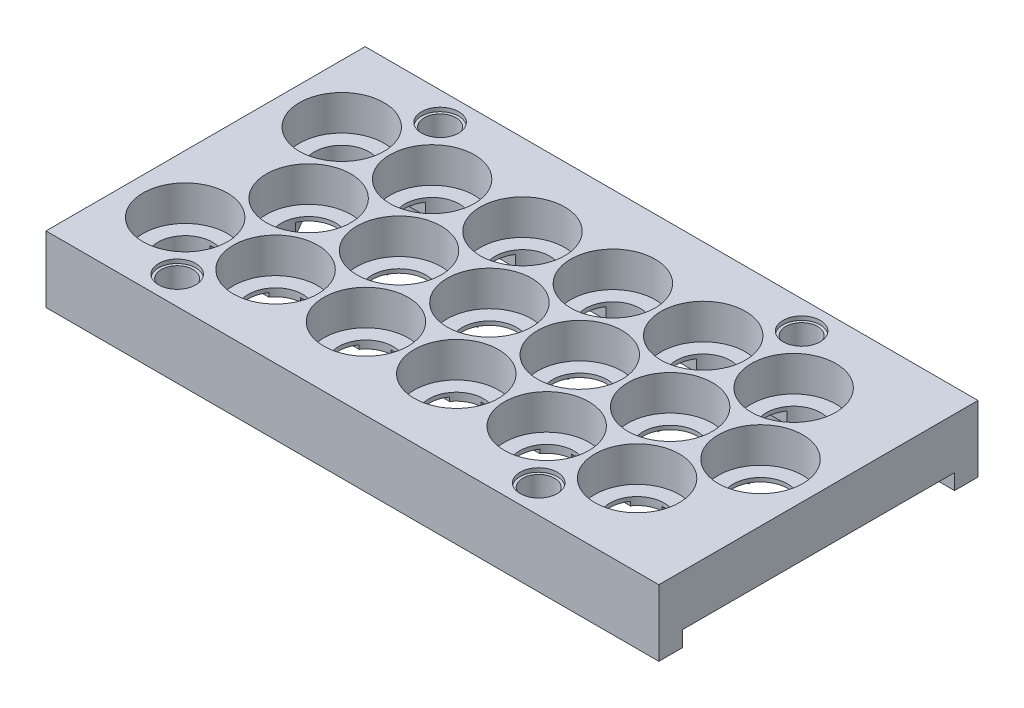
from build123d import *
from build123d.topology import SkipClean

# Parameters (mm, degrees)
SKETCH1_W            = 156.975
SKETCH1_H            = 81.746976195
SKETCH1_R            = 10.825
BOSS_EXTRUDE2_DEPTH  = 11
SKETCH1_3_R          = 10.825
SKETCH1_3_R_2        = 7
BOSS_EXTRUDE3_DEPTH  = 2
CUT_EXTRUDE1_DEPTH   = 1
CUT_EXTRUDE3_REACH   = 157.046
SKETCH9_R            = 4.0767
SKETCH10_R           = 4.7625
CUT_EXTRUDE4_DEPTH   = 1
SKETCH13_R           = 6.5
BOSS_EXTRUDE7_DEPTH  = 6
BOSS_EXTRUDE9_START  = 2
BOSS_EXTRUDE9_DEPTH  = 2
BOSS_EXTRUDE10_DEPTH = 2
SKETCH17_R           = 2
CUT_EXTRUDE5_DEPTH   = 4


with BuildPart() as part:
    # Sketch1 → Boss-Extrude2 (new body)
    with BuildSketch(Plane(origin=(0, 0, 0), x_dir=(1, 0, 0), z_dir=(0, 1, 0))):
        with Locations((63.6625, -20.048488098)):
            Rectangle(SKETCH1_W, SKETCH1_H)
        with Locations((0, -40.096976195)):
            Circle(SKETCH1_R, mode=Mode.SUBTRACT)
        with Locations((23.15, -40.096976195)):
            Circle(SKETCH1_R, mode=Mode.SUBTRACT)
        with Locations((46.3, -40.096976195)):
            Circle(SKETCH1_R, mode=Mode.SUBTRACT)
        with Locations((69.45, -40.096976195)):
            Circle(SKETCH1_R, mode=Mode.SUBTRACT)
        with Locations((92.6, -40.096976195)):
            Circle(SKETCH1_R, mode=Mode.SUBTRACT)
        with Locations((115.75, -40.096976195)):
            Circle(SKETCH1_R, mode=Mode.SUBTRACT)
        with Locations((11.575, -20.048488098)):
            Circle(SKETCH1_R, mode=Mode.SUBTRACT)
        Circle(SKETCH1_R, mode=Mode.SUBTRACT)
        with Locations((23.15, 0)):
            Circle(SKETCH1_R, mode=Mode.SUBTRACT)
        with Locations((34.725, -20.048488098)):
            Circle(SKETCH1_R, mode=Mode.SUBTRACT)
        with Locations((57.875, -20.048488098)):
            Circle(SKETCH1_R, mode=Mode.SUBTRACT)
        with Locations((46.3, 0)):
            Circle(SKETCH1_R, mode=Mode.SUBTRACT)
        with Locations((81.025, -20.048488098)):
            Circle(SKETCH1_R, mode=Mode.SUBTRACT)
        with Locations((69.45, 0)):
            Circle(SKETCH1_R, mode=Mode.SUBTRACT)
        with Locations((92.6, 0)):
            Circle(SKETCH1_R, mode=Mode.SUBTRACT)
        with Locations((104.175, -20.048488098)):
            Circle(SKETCH1_R, mode=Mode.SUBTRACT)
        with Locations((127.325, -20.048488098)):
            Circle(SKETCH1_R, mode=Mode.SUBTRACT)
        with Locations((115.75, 0)):
            Circle(SKETCH1_R, mode=Mode.SUBTRACT)
    extrude(amount=BOSS_EXTRUDE2_DEPTH)

    # Sketch1<3> → Boss-Extrude3 (add)
    # profile 1 of 18: a face of its own
    with BuildSketch(Plane(origin=(0, 0, 0), x_dir=(1, 0, 0), z_dir=(0, 1, 0))):
        Circle(SKETCH1_3_R)
        Circle(SKETCH1_3_R_2, mode=Mode.SUBTRACT)
    # profile 2 of 18: a face of its own
    with BuildSketch(Plane(origin=(0, 0, 0), x_dir=(1, 0, 0), z_dir=(0, 1, 0))):
        with Locations((11.575, -20.048488098)):
            Circle(SKETCH1_3_R)
        with Locations((11.575, -20.048488098)):
            Circle(SKETCH1_3_R_2, mode=Mode.SUBTRACT)
    # profile 3 of 18: a face of its own
    with BuildSketch(Plane(origin=(0, 0, 0), x_dir=(1, 0, 0), z_dir=(0, 1, 0))):
        with Locations((0, -40.096976195)):
            Circle(SKETCH1_3_R)
        with Locations((0, -40.096976195)):
            Circle(SKETCH1_3_R_2, mode=Mode.SUBTRACT)
    # profile 4 of 18: a face of its own
    with BuildSketch(Plane(origin=(0, 0, 0), x_dir=(1, 0, 0), z_dir=(0, 1, 0))):
        with Locations((23.15, 0)):
            Circle(SKETCH1_3_R)
        with Locations((23.15, 0)):
            Circle(SKETCH1_3_R_2, mode=Mode.SUBTRACT)
    # profile 5 of 18: a face of its own
    with BuildSketch(Plane(origin=(0, 0, 0), x_dir=(1, 0, 0), z_dir=(0, 1, 0))):
        with Locations((34.725, -20.048488098)):
            Circle(SKETCH1_3_R)
        with Locations((34.725, -20.048488098)):
            Circle(SKETCH1_3_R_2, mode=Mode.SUBTRACT)
    # profile 6 of 18: a face of its own
    with BuildSketch(Plane(origin=(0, 0, 0), x_dir=(1, 0, 0), z_dir=(0, 1, 0))):
        with Locations((23.15, -40.096976195)):
            Circle(SKETCH1_3_R)
        with Locations((23.15, -40.096976195)):
            Circle(SKETCH1_3_R_2, mode=Mode.SUBTRACT)
    # profile 7 of 18: a face of its own
    with BuildSketch(Plane(origin=(0, 0, 0), x_dir=(1, 0, 0), z_dir=(0, 1, 0))):
        with Locations((46.3, 0)):
            Circle(SKETCH1_3_R)
        with Locations((46.3, 0)):
            Circle(SKETCH1_3_R_2, mode=Mode.SUBTRACT)
    # profile 8 of 18: a face of its own
    with BuildSketch(Plane(origin=(0, 0, 0), x_dir=(1, 0, 0), z_dir=(0, 1, 0))):
        with Locations((57.875, -20.048488098)):
            Circle(SKETCH1_3_R)
        with Locations((57.875, -20.048488098)):
            Circle(SKETCH1_3_R_2, mode=Mode.SUBTRACT)
    # profile 9 of 18: a face of its own
    with BuildSketch(Plane(origin=(0, 0, 0), x_dir=(1, 0, 0), z_dir=(0, 1, 0))):
        with Locations((46.3, -40.096976195)):
            Circle(SKETCH1_3_R)
        with Locations((46.3, -40.096976195)):
            Circle(SKETCH1_3_R_2, mode=Mode.SUBTRACT)
    # profile 10 of 18: a face of its own
    with BuildSketch(Plane(origin=(0, 0, 0), x_dir=(1, 0, 0), z_dir=(0, 1, 0))):
        with Locations((69.45, 0)):
            Circle(SKETCH1_3_R)
        with Locations((69.45, 0)):
            Circle(SKETCH1_3_R_2, mode=Mode.SUBTRACT)
    # profile 11 of 18: a face of its own
    with BuildSketch(Plane(origin=(0, 0, 0), x_dir=(1, 0, 0), z_dir=(0, 1, 0))):
        with Locations((81.025, -20.048488098)):
            Circle(SKETCH1_3_R)
        with Locations((81.025, -20.048488098)):
            Circle(SKETCH1_3_R_2, mode=Mode.SUBTRACT)
    # profile 12 of 18: a face of its own
    with BuildSketch(Plane(origin=(0, 0, 0), x_dir=(1, 0, 0), z_dir=(0, 1, 0))):
        with Locations((69.45, -40.096976195)):
            Circle(SKETCH1_3_R)
        with Locations((69.45, -40.096976195)):
            Circle(SKETCH1_3_R_2, mode=Mode.SUBTRACT)
    # profile 13 of 18: a face of its own
    with BuildSketch(Plane(origin=(0, 0, 0), x_dir=(1, 0, 0), z_dir=(0, 1, 0))):
        with Locations((92.6, 0)):
            Circle(SKETCH1_3_R)
        with Locations((92.6, 0)):
            Circle(SKETCH1_3_R_2, mode=Mode.SUBTRACT)
    # profile 14 of 18: a face of its own
    with BuildSketch(Plane(origin=(0, 0, 0), x_dir=(1, 0, 0), z_dir=(0, 1, 0))):
        with Locations((104.175, -20.048488098)):
            Circle(SKETCH1_3_R)
        with Locations((104.175, -20.048488098)):
            Circle(SKETCH1_3_R_2, mode=Mode.SUBTRACT)
    # profile 15 of 18: a face of its own
    with BuildSketch(Plane(origin=(0, 0, 0), x_dir=(1, 0, 0), z_dir=(0, 1, 0))):
        with Locations((92.6, -40.096976195)):
            Circle(SKETCH1_3_R)
        with Locations((92.6, -40.096976195)):
            Circle(SKETCH1_3_R_2, mode=Mode.SUBTRACT)
    # profile 16 of 18: a face of its own
    with BuildSketch(Plane(origin=(0, 0, 0), x_dir=(1, 0, 0), z_dir=(0, 1, 0))):
        with Locations((115.75, 0)):
            Circle(SKETCH1_3_R)
        with Locations((115.75, 0)):
            Circle(SKETCH1_3_R_2, mode=Mode.SUBTRACT)
    # profile 17 of 18: a face of its own
    with BuildSketch(Plane(origin=(0, 0, 0), x_dir=(1, 0, 0), z_dir=(0, 1, 0))):
        with Locations((127.325, -20.048488098)):
            Circle(SKETCH1_3_R)
        with Locations((127.325, -20.048488098)):
            Circle(SKETCH1_3_R_2, mode=Mode.SUBTRACT)
    # profile 18 of 18: a face of its own
    with BuildSketch(Plane(origin=(0, 0, 0), x_dir=(1, 0, 0), z_dir=(0, 1, 0))):
        with Locations((115.75, -40.096976195)):
            Circle(SKETCH1_3_R)
        with Locations((115.75, -40.096976195)):
            Circle(SKETCH1_3_R_2, mode=Mode.SUBTRACT)
    extrude(amount=BOSS_EXTRUDE3_DEPTH)

    # Sketch2 → Cut-Extrude1 (cut)
    with BuildSketch(Plane.XZ):
        with BuildLine():
            Line((-0.591820292, 33.12203901), (5.238617062, 23.023425283))
            ThreePointArc((5.238617062, 23.023425283), (8.075, 26.110665924), (12.166820292, 27.023425283))
            Line((12.166820292, 27.023425283), (6.92820323, 36.096976195))
            Line((6.92820323, 36.096976195), (17.405437353, 36.096976195))
            ThreePointArc((17.405437353, 36.096976195), (16.15, 40.096976195), (17.405437353, 44.096976195))
            Line((17.405437353, 44.096976195), (5.744562647, 44.096976195))
            ThreePointArc((5.744562647, 44.096976195), (6.062177826, 36.596976195), (-0.591820292, 33.12203901))
        make_face()
        with BuildLine():
            Line((27.79679677, 24.048488098), (17.319562647, 24.048488098))
            ThreePointArc((17.319562647, 24.048488098), (18.575, 20.048488098), (17.319562647, 16.048488098))
            Line((17.319562647, 16.048488098), (27.79679677, 16.048488098))
            Line((27.79679677, 16.048488098), (22.558179708, 6.974937186))
            ThreePointArc((22.558179708, 6.974937186), (26.124937186, 6.336382938), (28.894562647, 4))
            Line((28.894562647, 4), (6.92820323, 4))
            Line((6.92820323, 4), (12.166820292, 13.073550912))
            ThreePointArc((12.166820292, 13.073550912), (8.075, 13.986310271), (5.238617062, 17.073550912))
            Line((5.238617062, 17.073550912), (-0.591820292, 6.974937186))
            ThreePointArc((-0.591820292, 6.974937186), (2.974937186, 6.336382938), (5.744562647, 4))
            Line((5.744562647, 4), (0, 4))
            ThreePointArc((0, 4), (-4, 0), (0, -4))
            Line((0, -4), (115.75, -4))
            ThreePointArc((115.75, -4), (119.75, 0), (115.75, 4))
            Line((115.75, 4), (99.52820323, 4))
            Line((99.52820323, 4), (104.766820292, 13.073550912))
            ThreePointArc((104.766820292, 13.073550912), (97.175, 20.048488098), (104.766820292, 27.023425283))
            Line((104.766820292, 27.023425283), (99.52820323, 36.096976195))
            Line((99.52820323, 36.096976195), (110.005437353, 36.096976195))
            ThreePointArc((110.005437353, 36.096976195), (108.75, 40.096976195), (110.005437353, 44.096976195))
            Line((110.005437353, 44.096976195), (98.344562647, 44.096976195))
            ThreePointArc((98.344562647, 44.096976195), (98.662177826, 36.596976195), (92.008179708, 33.12203901))
            Line((92.008179708, 33.12203901), (97.24679677, 24.048488098))
            Line((97.24679677, 24.048488098), (86.769562647, 24.048488098))
            ThreePointArc((86.769562647, 24.048488098), (88.025, 20.048488098), (86.769562647, 16.048488098))
            Line((86.769562647, 16.048488098), (97.24679677, 16.048488098))
            Line((97.24679677, 16.048488098), (92.008179708, 6.974937186))
            ThreePointArc((92.008179708, 6.974937186), (95.574937186, 6.336382938), (98.344562647, 4))
            Line((98.344562647, 4), (76.37820323, 4))
            Line((76.37820323, 4), (81.616820292, 13.073550912))
            ThreePointArc((81.616820292, 13.073550912), (74.025, 20.048488098), (81.616820292, 27.023425283))
            Line((81.616820292, 27.023425283), (76.37820323, 36.096976195))
            Line((76.37820323, 36.096976195), (86.855437353, 36.096976195))
            ThreePointArc((86.855437353, 36.096976195), (85.6, 40.096976195), (86.855437353, 44.096976195))
            Line((86.855437353, 44.096976195), (75.194562647, 44.096976195))
            ThreePointArc((75.194562647, 44.096976195), (75.512177826, 36.596976195), (68.858179708, 33.12203901))
            Line((68.858179708, 33.12203901), (74.09679677, 24.048488098))
            Line((74.09679677, 24.048488098), (63.619562647, 24.048488098))
            ThreePointArc((63.619562647, 24.048488098), (64.875, 20.048488098), (63.619562647, 16.048488098))
            Line((63.619562647, 16.048488098), (74.09679677, 16.048488098))
            Line((74.09679677, 16.048488098), (68.858179708, 6.974937186))
            ThreePointArc((68.858179708, 6.974937186), (72.424937186, 6.336382938), (75.194562647, 4))
            Line((75.194562647, 4), (53.22820323, 4))
            Line((53.22820323, 4), (58.466820292, 13.073550912))
            ThreePointArc((58.466820292, 13.073550912), (50.875, 20.048488098), (58.466820292, 27.023425283))
            Line((58.466820292, 27.023425283), (53.22820323, 36.096976195))
            Line((53.22820323, 36.096976195), (63.705437353, 36.096976195))
            ThreePointArc((63.705437353, 36.096976195), (62.45, 40.096976195), (63.705437353, 44.096976195))
            Line((63.705437353, 44.096976195), (52.044562647, 44.096976195))
            ThreePointArc((52.044562647, 44.096976195), (52.362177826, 36.596976195), (45.708179708, 33.12203901))
            Line((45.708179708, 33.12203901), (50.94679677, 24.048488098))
            Line((50.94679677, 24.048488098), (40.469562647, 24.048488098))
            ThreePointArc((40.469562647, 24.048488098), (41.725, 20.048488098), (40.469562647, 16.048488098))
            Line((40.469562647, 16.048488098), (50.94679677, 16.048488098))
            Line((50.94679677, 16.048488098), (45.708179708, 6.974937186))
            ThreePointArc((45.708179708, 6.974937186), (49.274937186, 6.336382938), (52.044562647, 4))
            Line((52.044562647, 4), (30.07820323, 4))
            Line((30.07820323, 4), (35.316820292, 13.073550912))
            ThreePointArc((35.316820292, 13.073550912), (27.725, 20.048488098), (35.316820292, 27.023425283))
            Line((35.316820292, 27.023425283), (30.07820323, 36.096976195))
            Line((30.07820323, 36.096976195), (40.555437353, 36.096976195))
            ThreePointArc((40.555437353, 36.096976195), (39.3, 40.096976195), (40.555437353, 44.096976195))
            Line((40.555437353, 44.096976195), (28.894562647, 44.096976195))
            ThreePointArc((28.894562647, 44.096976195), (29.212177826, 36.596976195), (22.558179708, 33.12203901))
            Line((22.558179708, 33.12203901), (27.79679677, 24.048488098))
        make_face()
        with BuildLine():
            Line((127.916820292, 27.023425283), (122.086382938, 37.12203901))
            ThreePointArc((122.086382938, 37.12203901), (119.25, 34.034798369), (115.158179708, 33.12203901))
            Line((115.158179708, 33.12203901), (120.39679677, 24.048488098))
            Line((120.39679677, 24.048488098), (109.919562647, 24.048488098))
            ThreePointArc((109.919562647, 24.048488098), (111.175, 20.048488098), (109.919562647, 16.048488098))
            Line((109.919562647, 16.048488098), (120.39679677, 16.048488098))
            Line((120.39679677, 16.048488098), (115.158179708, 6.974937186))
            ThreePointArc((115.158179708, 6.974937186), (119.25, 6.062177826), (122.086382938, 2.974937186))
            Line((122.086382938, 2.974937186), (127.916820292, 13.073550912))
            ThreePointArc((127.916820292, 13.073550912), (120.325, 20.048488098), (127.916820292, 27.023425283))
        make_face()
    extrude(amount=-CUT_EXTRUDE1_DEPTH, mode=Mode.SUBTRACT)

    # Sketch9 → Cut-Extrude3 (cut, up to next)
    with BuildSketch(Plane(origin=(0, 11, 0), x_dir=(1, 0, 0), z_dir=(0, 1, 0)), mode=Mode.PRIVATE) as cut_extrude3_sk1:
        with Locations((11.575, 13.625)):
            Circle(SKETCH9_R)
    cut_extrude3_tool1 = extrude(cut_extrude3_sk1.sketch, amount=-CUT_EXTRUDE3_REACH, mode=Mode.PRIVATE) & part.part
    # Sketch9 → Cut-Extrude3 (cut, up to next)
    with BuildSketch(Plane(origin=(0, 11, 0), x_dir=(1, 0, 0), z_dir=(0, 1, 0)), mode=Mode.PRIVATE) as cut_extrude3_sk2:
        with Locations((11.575, -53.721976195)):
            Circle(SKETCH9_R)
    cut_extrude3_tool2 = extrude(cut_extrude3_sk2.sketch, amount=-CUT_EXTRUDE3_REACH, mode=Mode.PRIVATE) & part.part
    # Sketch9 → Cut-Extrude3 (cut, up to next)
    with BuildSketch(Plane(origin=(0, 11, 0), x_dir=(1, 0, 0), z_dir=(0, 1, 0)), mode=Mode.PRIVATE) as cut_extrude3_sk3:
        with Locations((104.175, -53.721976195)):
            Circle(SKETCH9_R)
    cut_extrude3_tool3 = extrude(cut_extrude3_sk3.sketch, amount=-CUT_EXTRUDE3_REACH, mode=Mode.PRIVATE) & part.part
    # Sketch9 → Cut-Extrude3 (cut, up to next)
    with BuildSketch(Plane(origin=(0, 11, 0), x_dir=(1, 0, 0), z_dir=(0, 1, 0)), mode=Mode.PRIVATE) as cut_extrude3_sk4:
        with Locations((104.175, 13.625)):
            Circle(SKETCH9_R)
    cut_extrude3_tool4 = extrude(cut_extrude3_sk4.sketch, amount=-CUT_EXTRUDE3_REACH, mode=Mode.PRIVATE) & part.part
    add(cut_extrude3_tool1.solids().sort_by_distance((11.575, 11, -13.625))[0], mode=Mode.SUBTRACT)
    add(cut_extrude3_tool2.solids().sort_by_distance((11.575, 11, 53.721976))[0], mode=Mode.SUBTRACT)
    add(cut_extrude3_tool3.solids().sort_by_distance((104.175, 11, 53.721976))[0], mode=Mode.SUBTRACT)
    add(cut_extrude3_tool4.solids().sort_by_distance((104.175, 11, -13.625))[0], mode=Mode.SUBTRACT)

    # Sketch10 → Cut-Extrude4 (cut)
    with BuildSketch(Plane(origin=(0, 11, 0), x_dir=(1, 0, 0), z_dir=(0, 1, 0))):
        with Locations((11.575, 13.625)):
            Circle(SKETCH10_R)
        with Locations((104.175, 13.625)):
            Circle(SKETCH10_R)
        with Locations((104.175, -53.721976195)):
            Circle(SKETCH10_R)
        with Locations((11.575, -53.721976195)):
            Circle(SKETCH10_R)
    extrude(amount=-CUT_EXTRUDE4_DEPTH, mode=Mode.SUBTRACT)

    # Sketch13 → Boss-Extrude7 (add)
    # profile 1 of 2: a face of its own
    with BuildSketch(Plane.XZ):
        with BuildLine():
            ThreePointArc((3.665512027, 54.921976195), (11.575, 45.721976195), (19.484487973, 54.921976195))
            Line((19.484487973, 54.921976195), (96.265512027, 54.921976195))
            ThreePointArc((96.265512027, 54.921976195), (104.175, 45.721976195), (112.084487973, 54.921976195))
            Line((112.084487973, 54.921976195), (142.15, 54.921976195))
            Line((142.15, 54.921976195), (142.15, 60.921976195))
            Line((142.15, 60.921976195), (-14.825, 60.921976195))
            Line((-14.825, 60.921976195), (-14.825, 54.921976195))
            Line((-14.825, 54.921976195), (3.665512027, 54.921976195))
        make_face()
        with Locations((11.575, 53.721976195)):
            Circle(SKETCH13_R, mode=Mode.SUBTRACT)
        with Locations((104.175, 53.721976195)):
            Circle(SKETCH13_R, mode=Mode.SUBTRACT)
    # profile 2 of 2: a face of its own
    with BuildSketch(Plane.XZ):
        with BuildLine():
            Line((-14.825, -14.825), (-14.825, -20.825))
            Line((-14.825, -20.825), (142.15, -20.825))
            Line((142.15, -20.825), (142.15, -14.825))
            Line((142.15, -14.825), (112.084487973, -14.825))
            ThreePointArc((112.084487973, -14.825), (104.175, -5.625), (96.265512027, -14.825))
            Line((96.265512027, -14.825), (19.484487973, -14.825))
            ThreePointArc((19.484487973, -14.825), (11.575, -5.625), (3.665512027, -14.825))
            Line((3.665512027, -14.825), (-14.825, -14.825))
        make_face()
        with Locations((11.575, -13.625)):
            Circle(SKETCH13_R, mode=Mode.SUBTRACT)
        with Locations((104.175, -13.625)):
            Circle(SKETCH13_R, mode=Mode.SUBTRACT)
    extrude(amount=BOSS_EXTRUDE7_DEPTH)

    # Sketch14 → Boss-Extrude9 (add)
    with SkipClean():  # the faces are left unmerged after this step: merging them gives an invalid solid
        with BuildSketch(Plane.XZ.offset(BOSS_EXTRUDE9_START)):
            with BuildLine():
                Line((142.15, 54.921976195), (142.15, -14.825))
                Line((142.15, -14.825), (112.084487973, -14.825))
                ThreePointArc((112.084487973, -14.825), (104.175, -5.625), (96.265512027, -14.825))
                Line((96.265512027, -14.825), (19.484487973, -14.825))
                ThreePointArc((19.484487973, -14.825), (11.575, -5.625), (3.665512027, -14.825))
                Line((3.665512027, -14.825), (-14.825, -14.825))
                Line((-14.825, -14.825), (-14.825, 54.921976195))
                Line((-14.825, 54.921976195), (3.665512027, 54.921976195))
                ThreePointArc((3.665512027, 54.921976195), (11.575, 45.721976195), (19.484487973, 54.921976195))
                Line((19.484487973, 54.921976195), (96.265512027, 54.921976195))
                ThreePointArc((96.265512027, 54.921976195), (104.175, 45.721976195), (112.084487973, 54.921976195))
                Line((112.084487973, 54.921976195), (142.15, 54.921976195))
            make_face()
            with BuildLine():
                Line((5.238617062, 17.073550912), (-0.591820292, 6.974937186))
                ThreePointArc((-0.591820292, 6.974937186), (-6.062177826, -3.5), (5.744562647, -4))
                Line((5.744562647, -4), (17.405437353, -4))
                ThreePointArc((17.405437353, -4), (23.15, -7), (28.894562647, -4))
                Line((28.894562647, -4), (40.555437353, -4))
                ThreePointArc((40.555437353, -4), (46.3, -7), (52.044562647, -4))
                Line((52.044562647, -4), (63.705437353, -4))
                ThreePointArc((63.705437353, -4), (69.45, -7), (75.194562647, -4))
                Line((75.194562647, -4), (86.855437353, -4))
                ThreePointArc((86.855437353, -4), (92.6, -7), (98.344562647, -4))
                Line((98.344562647, -4), (110.005437353, -4))
                ThreePointArc((110.005437353, -4), (119.25, -6.062177826), (122.086382938, 2.974937186))
                Line((122.086382938, 2.974937186), (127.916820292, 13.073550912))
                ThreePointArc((127.916820292, 13.073550912), (134.325, 20.048488098), (127.916820292, 27.023425283))
                Line((127.916820292, 27.023425283), (122.086382938, 37.12203901))
                ThreePointArc((122.086382938, 37.12203901), (119.25, 46.159154022), (110.005437353, 44.096976195))
                Line((110.005437353, 44.096976195), (98.344562647, 44.096976195))
                ThreePointArc((98.344562647, 44.096976195), (92.6, 47.096976195), (86.855437353, 44.096976195))
                Line((86.855437353, 44.096976195), (75.194562647, 44.096976195))
                ThreePointArc((75.194562647, 44.096976195), (69.45, 47.096976195), (63.705437353, 44.096976195))
                Line((63.705437353, 44.096976195), (52.044562647, 44.096976195))
                ThreePointArc((52.044562647, 44.096976195), (46.3, 47.096976195), (40.555437353, 44.096976195))
                Line((40.555437353, 44.096976195), (28.894562647, 44.096976195))
                ThreePointArc((28.894562647, 44.096976195), (23.15, 47.096976195), (17.405437353, 44.096976195))
                Line((17.405437353, 44.096976195), (5.744562647, 44.096976195))
                ThreePointArc((5.744562647, 44.096976195), (-6.062177826, 43.596976195), (-0.591820292, 33.12203901))
                Line((-0.591820292, 33.12203901), (5.238617062, 23.023425283))
                ThreePointArc((5.238617062, 23.023425283), (4.575, 20.048488098), (5.238617062, 17.073550912))
            make_face(mode=Mode.SUBTRACT)
        extrude(amount=-BOSS_EXTRUDE9_DEPTH)

    # Sketch16 → Boss-Extrude10 (add)
    with SkipClean():  # the faces are left unmerged after this step: merging them gives an invalid solid
        with BuildSketch(Plane.XZ):
            with BuildLine():
                Line((15.536128823, 32.859238845), (20.688871177, 29.884301659))
                ThreePointArc((20.688871177, 29.884301659), (21.237909283, 27.835263554), (19.188871177, 27.286225448))
                Line((19.188871177, 27.286225448), (14.036128823, 30.261162634))
                ThreePointArc((14.036128823, 30.261162634), (13.487090717, 32.310200739), (15.536128823, 32.859238845))
            make_face()
            with BuildLine():
                Line((38.686128823, 32.859238845), (43.838871177, 29.884301659))
                ThreePointArc((43.838871177, 29.884301659), (44.387909283, 27.835263554), (42.338871177, 27.286225448))
                Line((42.338871177, 27.286225448), (37.186128823, 30.261162634))
                ThreePointArc((37.186128823, 30.261162634), (36.637090717, 32.310200739), (38.686128823, 32.859238845))
            make_face()
            with BuildLine():
                Line((61.836128823, 32.859238845), (66.988871177, 29.884301659))
                ThreePointArc((66.988871177, 29.884301659), (67.537909283, 27.835263554), (65.488871177, 27.286225448))
                Line((65.488871177, 27.286225448), (60.336128823, 30.261162634))
                ThreePointArc((60.336128823, 30.261162634), (59.787090717, 32.310200739), (61.836128823, 32.859238845))
            make_face()
            with BuildLine():
                Line((84.986128823, 32.859238845), (90.138871177, 29.884301659))
                ThreePointArc((90.138871177, 29.884301659), (90.687909283, 27.835263554), (88.638871177, 27.286225448))
                Line((88.638871177, 27.286225448), (83.486128823, 30.261162634))
                ThreePointArc((83.486128823, 30.261162634), (82.937090717, 32.310200739), (84.986128823, 32.859238845))
            make_face()
            with BuildLine():
                Line((108.136128823, 32.859238845), (113.288871177, 29.884301659))
                ThreePointArc((113.288871177, 29.884301659), (113.837909283, 27.835263554), (111.788871177, 27.286225448))
                Line((111.788871177, 27.286225448), (106.636128823, 30.261162634))
                ThreePointArc((106.636128823, 30.261162634), (106.087090717, 32.310200739), (108.136128823, 32.859238845))
            make_face()
            with BuildLine():
                Line((15.536128823, 7.23773735), (20.688871177, 10.212674536))
                ThreePointArc((20.688871177, 10.212674536), (21.237909283, 12.261712642), (19.188871177, 12.810750747))
                Line((19.188871177, 12.810750747), (14.036128823, 9.835813562))
                ThreePointArc((14.036128823, 9.835813562), (13.487090717, 7.786775456), (15.536128823, 7.23773735))
            make_face()
            with BuildLine():
                Line((38.686128823, 7.23773735), (43.838871177, 10.212674536))
                ThreePointArc((43.838871177, 10.212674536), (44.387909283, 12.261712642), (42.338871177, 12.810750747))
                Line((42.338871177, 12.810750747), (37.186128823, 9.835813562))
                ThreePointArc((37.186128823, 9.835813562), (36.637090717, 7.786775456), (38.686128823, 7.23773735))
            make_face()
            with BuildLine():
                Line((61.836128823, 7.23773735), (66.988871177, 10.212674536))
                ThreePointArc((66.988871177, 10.212674536), (67.537909283, 12.261712642), (65.488871177, 12.810750747))
                Line((65.488871177, 12.810750747), (60.336128823, 9.835813562))
                ThreePointArc((60.336128823, 9.835813562), (59.787090717, 7.786775456), (61.836128823, 7.23773735))
            make_face()
            with BuildLine():
                Line((84.986128823, 7.23773735), (90.138871177, 10.212674536))
                ThreePointArc((90.138871177, 10.212674536), (90.687909283, 12.261712642), (88.638871177, 12.810750747))
                Line((88.638871177, 12.810750747), (83.486128823, 9.835813562))
                ThreePointArc((83.486128823, 9.835813562), (82.937090717, 7.786775456), (84.986128823, 7.23773735))
            make_face()
            with BuildLine():
                Line((108.136128823, 7.23773735), (113.288871177, 10.212674536))
                ThreePointArc((113.288871177, 10.212674536), (113.837909283, 12.261712642), (111.788871177, 12.810750747))
                Line((111.788871177, 12.810750747), (106.636128823, 9.835813562))
                ThreePointArc((106.636128823, 9.835813562), (106.087090717, 7.786775456), (108.136128823, 7.23773735))
            make_face()
        extrude(amount=BOSS_EXTRUDE10_DEPTH)

    # Sketch17 → Cut-Extrude5 (cut)
    with BuildSketch(Plane(origin=(0, -2, 0), x_dir=(-1, 0, 0), z_dir=(0, -1, 0))):
        with Locations((10.825, -49.509476195)):
            Circle(SKETCH17_R)
        with Locations((-57.875, -49.509476195)):
            Circle(SKETCH17_R)
        with Locations((-132.15, -49.509476195)):
            Circle(SKETCH17_R)
        with Locations((-132.15, 9.4125)):
            Circle(SKETCH17_R)
        with Locations((-57.875, 9.4125)):
            Circle(SKETCH17_R)
        with Locations((10.825, 9.4125)):
            Circle(SKETCH17_R)
    extrude(amount=-CUT_EXTRUDE5_DEPTH, mode=Mode.SUBTRACT)


solid = part.part
